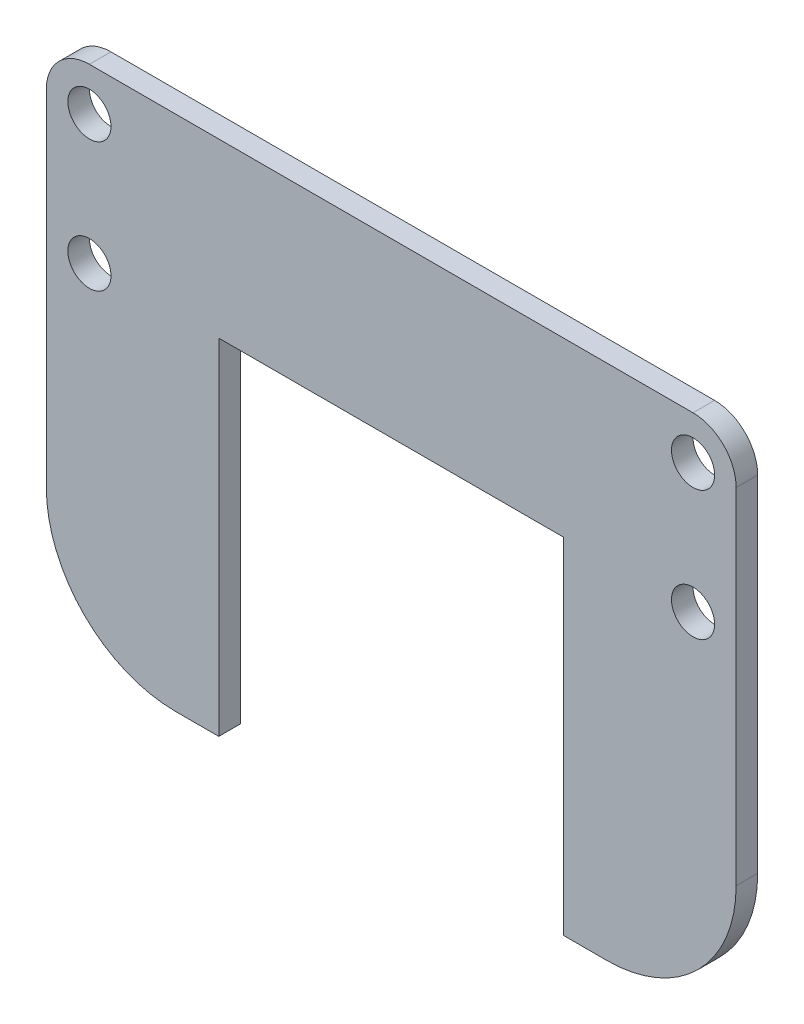
from build123d import *

# Parameters (mm, degrees)
SKETCH1_R           = 1.5875
BOSS_EXTRUDE1_DEPTH = 1.5875
FILLET1_R           = 9.525
FILLET2_R           = 3.175


with BuildPart() as part:
    # Sketch1 → Boss-Extrude1 (new body)
    with BuildSketch(Plane.XY):
        Polygon((12.7, 12.7), (12.7, -12.7), (25.4, -12.7), (25.4, 25.4), (-25.4, 25.4), (-25.4, -12.7), (-12.7, -12.7), (-12.7, 12.7), align=None)
        with Locations((-22.225, 12.7)):
            Circle(SKETCH1_R, mode=Mode.SUBTRACT)
        with Locations((-22.225, 22.225)):
            Circle(SKETCH1_R, mode=Mode.SUBTRACT)
        with Locations((22.225, 12.7)):
            Circle(SKETCH1_R, mode=Mode.SUBTRACT)
        with Locations((22.225, 22.225)):
            Circle(SKETCH1_R, mode=Mode.SUBTRACT)
    extrude(amount=BOSS_EXTRUDE1_DEPTH)

    # Fillet1
    fillet1_edges = [part.edges().sort_by_distance(p)[0] for p in [
        (25.4, -12.7, 0.79375),
        (-25.4, -12.7, 0.79375),
    ]]
    fillet(fillet1_edges, radius=FILLET1_R)

    # Fillet2
    fillet2_edges = [part.edges().sort_by_distance(p)[0] for p in [
        (25.4, 25.4, 0.79375),
        (-25.4, 25.4, 0.79375),
    ]]
    fillet(fillet2_edges, radius=FILLET2_R)


solid = part.part
